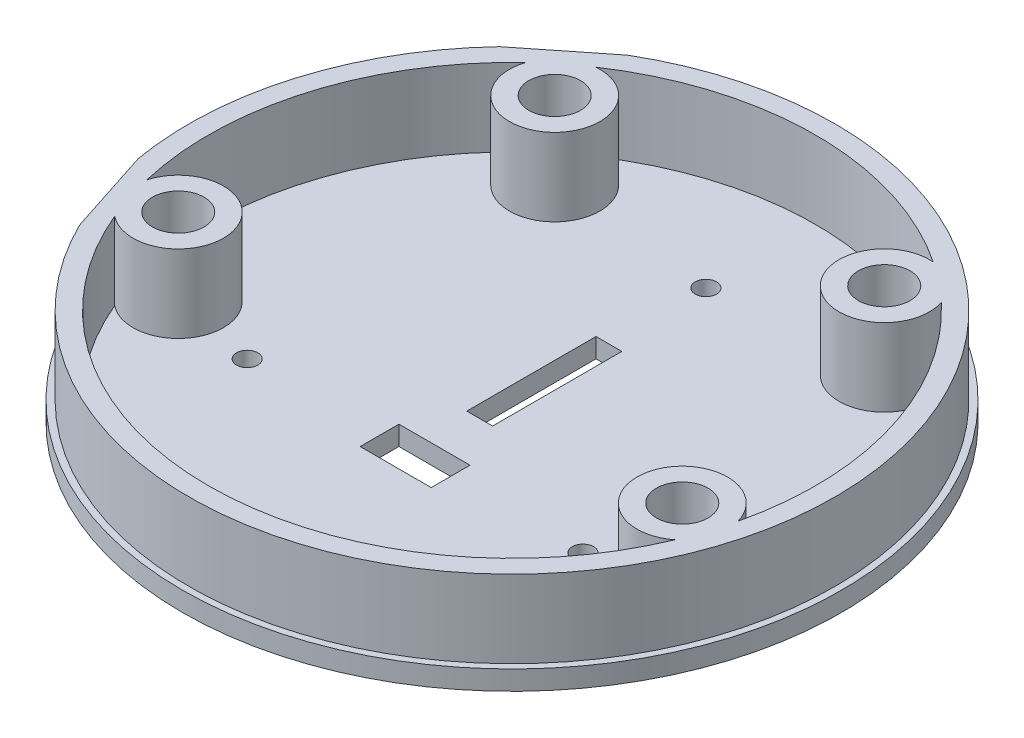
from build123d import *

# Parameters (mm, degrees)
SKETCH_1_R               = 51
EXTRUDE_1_DEPTH          = 3
SKETCH_2_R               = 50
SKETCH_2_R_2             = 47
EXTRUDE_2_DEPTH          = 12
SKETCH_5_R               = 1.65
CUT_EXTRUDE_1_DEPTH      = 10
PATTERN_CIRCULAR_1_COUNT = 3
SKETCH_6_W               = 4
SKETCH_6_H               = 20
SKETCH_6_W_2             = 11
SKETCH_6_H_2             = 6
CUT_EXTRUDE_2_DEPTH      = 10
SKETCH_7_R               = 7
SKETCH_7_R_2             = 4
EXTRUDE_3_DEPTH          = 12
CUT_EXTRUDE_START        = -12
CUT_EXTRUDE_3_DEPTH      = 12


with BuildPart() as part:
    # Эскиз1 → Бобышка-Вытянуть1 (new body)
    with BuildSketch(Plane(origin=(0, 0, 0), x_dir=(1, 0, 0), z_dir=(0, 1, 0))):
        Circle(SKETCH_1_R)
    extrude(amount=EXTRUDE_1_DEPTH)

    # Эскиз2 → Бобышка-Вытянуть2 (add)
    with BuildSketch(Plane(origin=(0, 3, 0), x_dir=(1, 0, 0), z_dir=(0, 1, 0))):
        Circle(SKETCH_2_R)
        Circle(SKETCH_2_R_2, mode=Mode.SUBTRACT)
    extrude(amount=EXTRUDE_2_DEPTH)

    # Эскиз5 → Вырез-Вытянуть1 (cut)
    with BuildSketch(Plane(origin=(0, 3, 0), x_dir=(1, 0, 0), z_dir=(0, 1, 0))):
        with Locations((0, 30)):
            Circle(SKETCH_5_R)
    cut_extrude_1 = extrude(amount=-CUT_EXTRUDE_1_DEPTH, mode=Mode.SUBTRACT)

    # Круговой массив1: Вырез-Вытянуть1 ×3 about axis
    pattern_circular_1_axis = Axis((0, 15, 0), (0, -1, 0))
    for i in range(1, PATTERN_CIRCULAR_1_COUNT):
        add(cut_extrude_1.rotate(pattern_circular_1_axis, i * 360 / PATTERN_CIRCULAR_1_COUNT), mode=Mode.SUBTRACT)

    # Эскиз6 → Вырез-Вытянуть2 (cut)
    with BuildSketch(Plane(origin=(0, 3, 0), x_dir=(1, 0, 0), z_dir=(0, 1, 0))):
        with Locations((0, 5)):
            Rectangle(SKETCH_6_W, SKETCH_6_H)
        with Locations((0, -15)):
            Rectangle(SKETCH_6_W_2, SKETCH_6_H_2)
    extrude(amount=-CUT_EXTRUDE_2_DEPTH, mode=Mode.SUBTRACT)

    # Эскиз7 → Бобышка-Вытянуть3 (add)
    # profile 1 of 4: a face of its own
    with BuildSketch(Plane(origin=(0, 3, 0), x_dir=(1, 0, 0), z_dir=(0, 1, 0))):
        with Locations((-39, -12.649110641)):
            Circle(SKETCH_7_R)
        with Locations((-39, -12.649110641)):
            Circle(SKETCH_7_R_2, mode=Mode.SUBTRACT)
    # profile 2 of 4: a face of its own
    with BuildSketch(Plane(origin=(0, 3, 0), x_dir=(1, 0, 0), z_dir=(0, 1, 0))):
        with Locations((39, -12.649110641)):
            Circle(SKETCH_7_R)
        with Locations((39, -12.649110641)):
            Circle(SKETCH_7_R_2, mode=Mode.SUBTRACT)
    # profile 3 of 4: a face of its own
    with BuildSketch(Plane(origin=(0, 3, 0), x_dir=(1, 0, 0), z_dir=(0, 1, 0))):
        with Locations((-25.5, 32.105295513)):
            Circle(SKETCH_7_R)
        with Locations((-25.5, 32.105295513)):
            Circle(SKETCH_7_R_2, mode=Mode.SUBTRACT)
    # profile 4 of 4: a face of its own
    with BuildSketch(Plane(origin=(0, 3, 0), x_dir=(1, 0, 0), z_dir=(0, 1, 0))):
        with Locations((25.5, 32.105295513)):
            Circle(SKETCH_7_R)
        with Locations((25.5, 32.105295513)):
            Circle(SKETCH_7_R_2, mode=Mode.SUBTRACT)
    extrude(amount=EXTRUDE_3_DEPTH)

    # Эскиз8 → Вырез-Вытянуть3 (cut)
    with BuildSketch(Plane(origin=(0, 15, 0), x_dir=(1, 0, 0), z_dir=(0, 1, 0)).offset(CUT_EXTRUDE_START)):
        with BuildLine():
            Line((-49.261434929, -8.562185978), (-44.909296778, -21.980788496))
            ThreePointArc((-44.909296778, -21.980788496), (-47.56097561, -15.425744684), (-49.261434929, -8.562185978))
        make_face()
        with BuildLine():
            Line((-36.309767407, 34.37442059), (-25.263403325, 43.148122235))
            ThreePointArc((-25.263403325, 43.148122235), (-31.097560976, 39.152799407), (-36.309767407, 34.37442059))
        make_face()
    extrude(amount=CUT_EXTRUDE_3_DEPTH, mode=Mode.SUBTRACT)


solid = part.part
